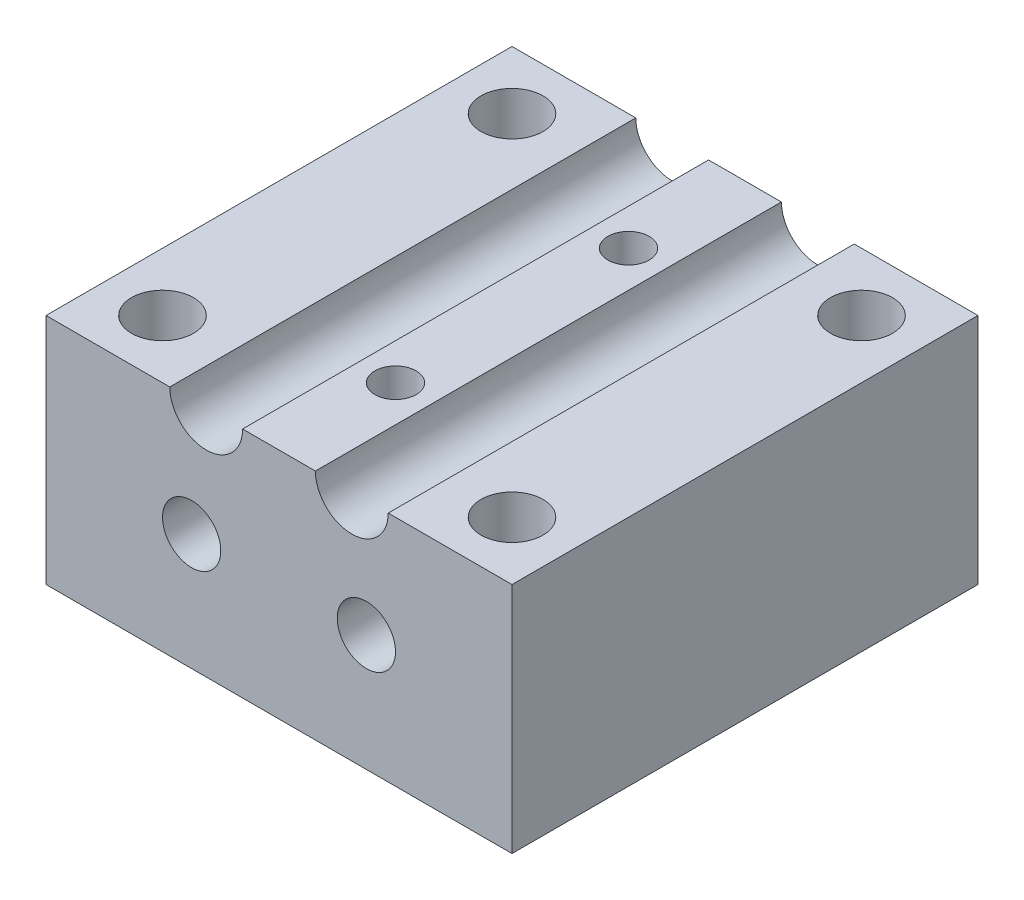
from build123d import *

# Parameters (mm, degrees)
SKETCH1_W               = 50.8
SKETCH1_H               = 50.8
BOSS_EXTRUDE1_DEPTH     = 25.4
SKETCH2_R               = 3.96875
CUT_EXTRUDE1_DEPTH      = 63.217039467
F_1_4_CLEARANCE_HOLE1_D = 6.7564
SKETCH6_R               = 3.175
CUT_EXTRUDE2_DEPTH      = 63.217039467
F_8_CLEARANCE_HOLE1_D   = 4.4958


with BuildPart() as part:
    # Sketch1 → Boss-Extrude1 (new body)
    with BuildSketch(Plane(origin=(0, 0, 0), x_dir=(1, 0, 0), z_dir=(0, 1, 0))):
        Rectangle(SKETCH1_W, SKETCH1_H)
    extrude(amount=BOSS_EXTRUDE1_DEPTH)

    # Sketch2 → Cut-Extrude1 (cut, through all)
    with BuildSketch(Plane.XY.offset(25.4)):
        with Locations((-7.9375, 25.4)):
            Circle(SKETCH2_R)
        with Locations((7.9375, 25.4)):
            Circle(SKETCH2_R)
    extrude(amount=-CUT_EXTRUDE1_DEPTH, mode=Mode.SUBTRACT)

    # 1/4 Clearance Hole1 (through all)
    with Locations(Plane(origin=(0, 25.4, 0), x_dir=(1, 0, 0), z_dir=(0, 1, 0))):
        with Locations((-19.05, 19.05), (-19.05, -19.05), (19.05, -19.05), (19.05, 19.05)):
            Hole(F_1_4_CLEARANCE_HOLE1_D / 2)

    # Sketch6 → Cut-Extrude2 (cut, through all)
    with BuildSketch(Plane.XY.offset(25.4)):
        with Locations((-9.525, 12.7)):
            Circle(SKETCH6_R)
        with Locations((9.525, 12.7)):
            Circle(SKETCH6_R)
    extrude(amount=-CUT_EXTRUDE2_DEPTH, mode=Mode.SUBTRACT)

    # #8 Clearance Hole1 (through all)
    with Locations(Plane(origin=(0, 25.4, 0), x_dir=(1, 0, 0), z_dir=(0, 1, 0))):
        with Locations((0, 12.7), (0, -12.7)):
            Hole(F_8_CLEARANCE_HOLE1_D / 2)


solid = part.part
